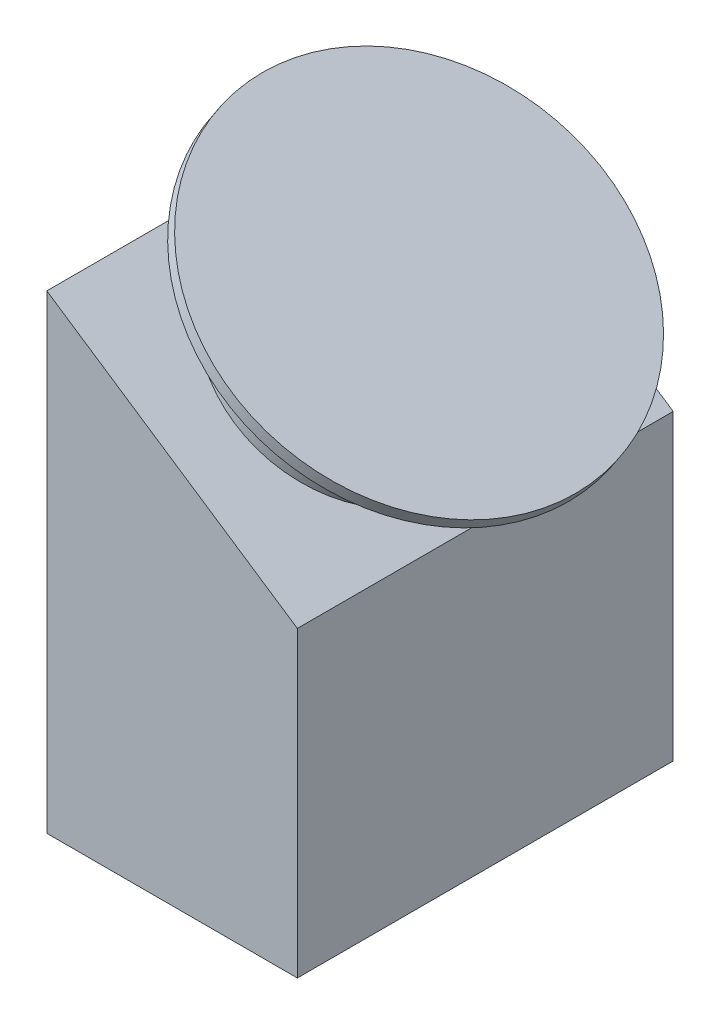
from build123d import *

# Parameters (mm, degrees)
BOSS_EXTRUDE1_DEPTH = 120
SKETCH2_R           = 40
BOSS_EXTRUDE2_DEPTH = 30
SKETCH4_R           = 60
BOSS_EXTRUDE3_DEPTH = 4
SHELL1_START        = 3
SHELL1_DEPTH        = 114
SHELL1_START_2      = 37.215764226
SHELL1_2_OUTLINE_R  = 37
SHELL1_2_DEPTH      = 34


with BuildPart() as part:
    # Sketch1 → Boss-Extrude1 (new body)
    with BuildSketch(Plane.XY):
        Polygon((40, 21.666666667), (-40, 75), (-40, -75), (40, -75), align=None)
    extrude(amount=BOSS_EXTRUDE1_DEPTH)

    # Sketch2 → Boss-Extrude2 (add)
    with BuildSketch(Plane(origin=(22.307692308, 33.461538462, 0), x_dir=(0, 0, -1), z_dir=(0.5547001962252291, 0.8320502943378437, 0))):
        with Locations(Location((-60, 26.810509484, 0), (0, 0, 90))):
            Circle(SKETCH2_R)
    extrude(amount=BOSS_EXTRUDE2_DEPTH)

    # Sketch4 → Boss-Extrude3 (add)
    with BuildSketch(Plane(origin=(38.948698194, 58.423047292, 0), x_dir=(0, 0, -1), z_dir=(0.5547001962252291, 0.8320502943378437, 0))):
        with Locations(Location((-60, 26.810509484, 0), (0, 0, 90))):
            Circle(SKETCH4_R)
    extrude(amount=BOSS_EXTRUDE3_DEPTH)

    # Shell1: read off the stored shape, not the designer's step
    # Shell1 outline → Shell1 (cut)
    with BuildSketch(Plane.XY.offset(SHELL1_START)):
        Polygon((-37, -72), (37, -72), (37, 20.061115391), (-37, 69.394448725), align=None)
    extrude(amount=SHELL1_DEPTH, mode=Mode.SUBTRACT)

    # Shell1 2 outline → Shell1 2 (cut)
    with BuildSketch(Plane(origin=(0, 0, 0), x_dir=(0.8320502943378438, -0.5547001962252289, 0), z_dir=(0.5547001962252289, 0.8320502943378438, 0)).offset(SHELL1_START_2)):
        with Locations((-26.810509484, -60)):
            Circle(SHELL1_2_OUTLINE_R)
    extrude(amount=SHELL1_2_DEPTH, mode=Mode.SUBTRACT)


solid = part.part
